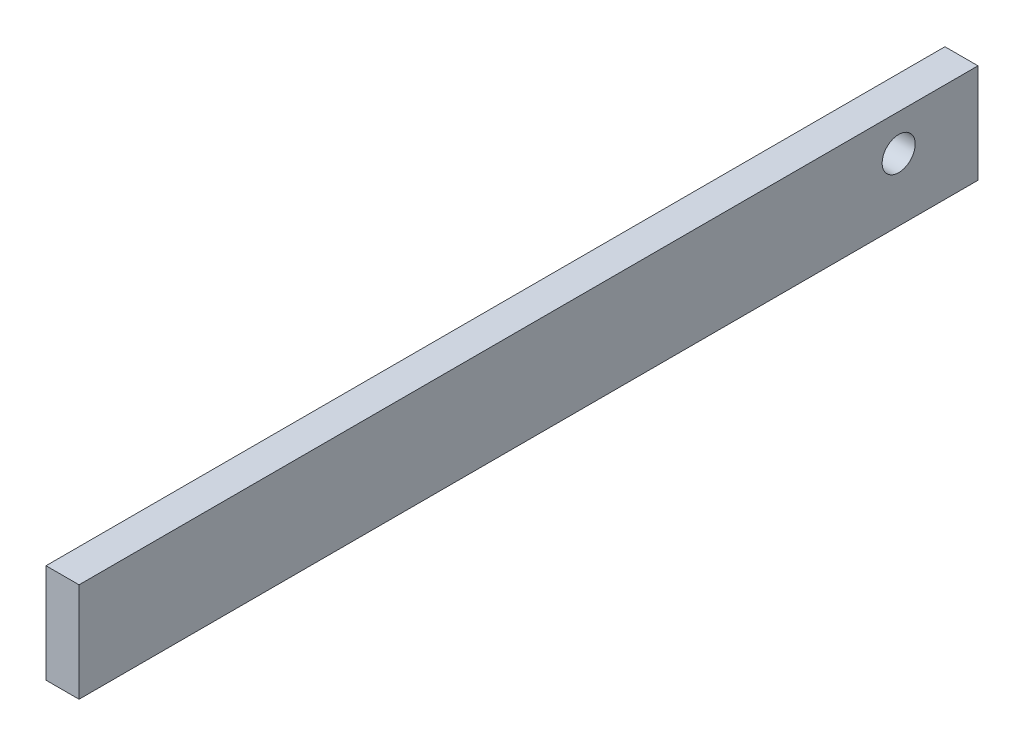
from build123d import *

# Parameters (mm, degrees)
BOSS_EXTRUDE1_DEPTH = 172.72
CUT_EXTRUDE1_REACH  = 176.231
SKETCH2_R           = 3.175
SKETCH5_W           = 6.35
SKETCH5_H           = 6.35
CUT_EXTRUDE4_DEPTH  = 345.44


with BuildPart() as part:
    # Sketch1 → Boss-Extrude1 (new body)
    with BuildSketch(Plane.XY):
        Polygon((0, 0), (-12.7, 0), (-12.7, 19.05), (-6.35, 19.05), (-6.35, 6.35), (0, 6.35), align=None)
    extrude(amount=-BOSS_EXTRUDE1_DEPTH)

    # Sketch2 → Cut-Extrude1 (cut, up to next)
    with BuildSketch(Plane.ZY.offset(12.7), mode=Mode.PRIVATE) as cut_extrude1_sk1:
        with Locations((-157.48, 12.065)):
            Circle(SKETCH2_R)
    cut_extrude1_tool1 = extrude(cut_extrude1_sk1.sketch, amount=-CUT_EXTRUDE1_REACH, mode=Mode.PRIVATE) & part.part
    add(cut_extrude1_tool1.solids().sort_by_distance((-12.7, 12.065, -157.48))[0], mode=Mode.SUBTRACT)

    # Sketch5 → Cut-Extrude4 (cut)
    with BuildSketch(Plane(origin=(0, 0, -172.72), x_dir=(-1, 0, 0), z_dir=(0, 0, -1))):
        with Locations((3.175, 3.175)):
            Rectangle(SKETCH5_W, SKETCH5_H)
    extrude(amount=-CUT_EXTRUDE4_DEPTH, mode=Mode.SUBTRACT)


solid = part.part
